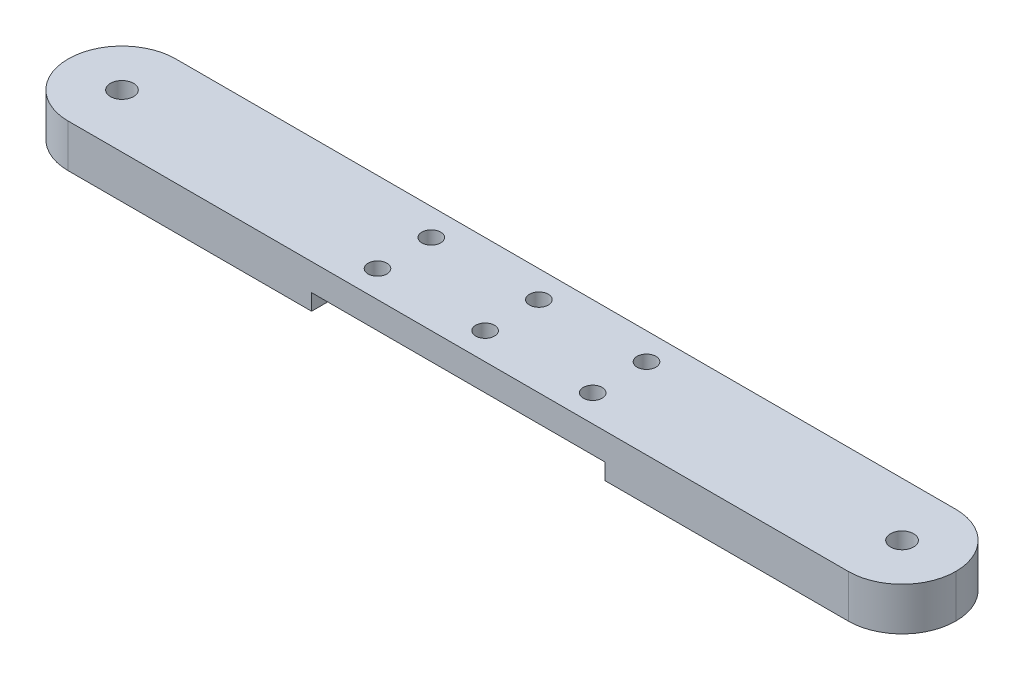
from build123d import *

# Parameters (mm, degrees)
EXTRUDE_1_DEPTH     = 20
SKETCH_2_R          = 2.15
SKETCH_2_R_2        = 1.75
CUT_EXTRUDE_1_DEPTH = 20
FILLET_1_R          = 10


with BuildPart() as part:
    # 스케치1 → 보스-돌출1 (new body)
    with BuildSketch(Plane.XY):
        Polygon((28, -2.5), (83.25, -2.5), (83.25, 5.5), (-81.75, 5.5), (-81.75, -2.5), (-26.5, -2.5), (-26.5, 0.5), (28, 0.5), align=None)
    extrude(amount=EXTRUDE_1_DEPTH)

    # 스케치2 → 컷-돌출1 (cut)
    with BuildSketch(Plane(origin=(0, 5.5, 0), x_dir=(1, 0, 0), z_dir=(0, 1, 0))):
        with Locations(Location((-71.75, -10, 0), (0, 0, 270))):
            Circle(SKETCH_2_R)
        with Locations(Location((73.25, -10, 0), (0, 0, 270))):
            Circle(SKETCH_2_R)
        with Locations(Location((-19.25, -5, 0), (0, 0, 270))):
            Circle(SKETCH_2_R_2)
        with Locations(Location((0.75, -5, 0), (0, 0, 270))):
            Circle(SKETCH_2_R_2)
        with Locations(Location((20.75, -5, 0), (0, 0, 270))):
            Circle(SKETCH_2_R_2)
        with Locations(Location((20.75, -15, 0), (0, 0, 270))):
            Circle(SKETCH_2_R_2)
        with Locations(Location((0.75, -15, 0), (0, 0, 270))):
            Circle(SKETCH_2_R_2)
        with Locations(Location((-19.25, -15, 0), (0, 0, 270))):
            Circle(SKETCH_2_R_2)
    extrude(amount=-CUT_EXTRUDE_1_DEPTH, mode=Mode.SUBTRACT)

    # 필렛1
    fillet_1_edges = [part.edges().sort_by_distance(p)[0] for p in [
        (83.25, 1.5, 0),
        (83.25, 1.5, 20),
        (-81.75, 1.5, 0),
        (-81.75, 1.5, 20),
    ]]
    fillet(fillet_1_edges, radius=FILLET_1_R - 0.0001)  # a hair under: the kernel refuses the full size


solid = part.part
